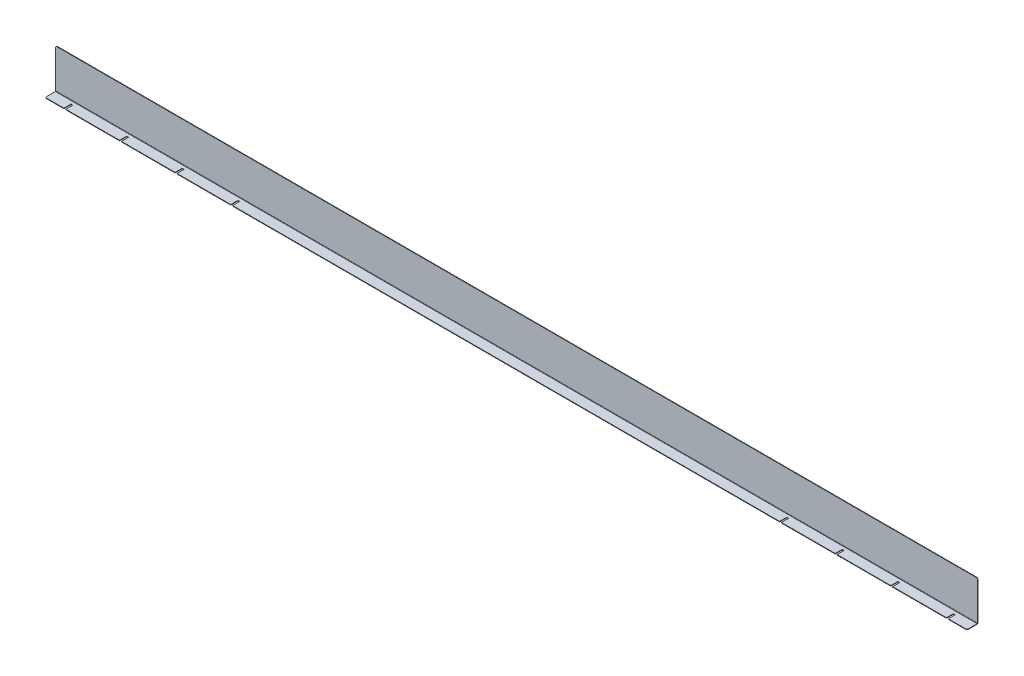
from build123d import *

# Parameters (mm, degrees)
BASE_FLANGE1_DEPTH       = 1761
FILLET1_R                = 5
SKETCH2_W                = 7
SKETCH2_H                = 35
CUT_EXTRUDE1_DEPTH       = 10
PATTERN_LINEAR_1_COUNT   = 4
PATTERN_LINEAR_1_PITCH   = 212.51
MIRROR_1_COPY_1_SKETCH_W = 7
MIRROR_1_COPY_1_SKETCH_H = 35
MIRROR_1_COPY_1_DEPTH    = 10
MIRROR_1_COPY_2_SKETCH_W = 7
MIRROR_1_COPY_2_SKETCH_H = 35
MIRROR_1_COPY_2_DEPTH    = 10
MIRROR_1_COPY_3_SKETCH_W = 7
MIRROR_1_COPY_3_SKETCH_H = 35
MIRROR_1_COPY_3_DEPTH    = 10


# Sheet-metal steps are written as plain solids
with BuildPart() as part:
    # Sketch1 → Base-Flange1 (new, symmetric)
    with BuildSketch(Plane(origin=(0, 0, 0), x_dir=(0, 0, -1), z_dir=(1, 0, 0))):
        with BuildLine():
            Line((-40, 0), (-1.3, 0))
            ThreePointArc((-1.3, 0), (-0.380761184, 0.380761184), (0, 1.3))
            Line((0, 1.3), (0, 150))
            Line((0, 150), (2, 150))
            Line((2, 150), (2, 1.3))
            ThreePointArc((2, 1.3), (1.033452378, -1.033452378), (-1.3, -2))
            Line((-1.3, -2), (-40, -2))
            Line((-40, -2), (-40, 0))
        make_face()
    extrude(amount=BASE_FLANGE1_DEPTH, both=True)

    # Fillet1
    fillet1_edges = [part.edges().sort_by_distance(p)[0] for p in [
        (1761, -1, 40),
        (-1761, -1, 40),
        (1761, 150, -1),
        (-1761, 150, -1),
    ]]
    fillet(fillet1_edges, radius=FILLET1_R)

    # Sketch2 → Cut-Extrude1 (cut)
    with BuildSketch(Plane(origin=(0, 0, 0), x_dir=(1, 0, 0), z_dir=(0, 1, 0))):
        with Locations((-1686, -30.5)):
            Rectangle(SKETCH2_W, SKETCH2_H)
    cut_extrude1 = extrude(amount=-CUT_EXTRUDE1_DEPTH, mode=Mode.SUBTRACT)

    # 阵列(线性)1: Cut-Extrude1 ×4
    with Locations(*[(i * PATTERN_LINEAR_1_PITCH, 0, 0) for i in range(1, PATTERN_LINEAR_1_COUNT)]):
        add(cut_extrude1, mode=Mode.SUBTRACT)

    # 镜向1: Cut-Extrude1 across plane
    add(cut_extrude1.mirror(Plane.ZY), mode=Mode.SUBTRACT)

    # 镜向1 copy 1 sketch → 镜向1 copy 1 (cut)
    with BuildSketch(Plane(origin=(-212.51, 0, 0), x_dir=(-1, 0, 0), z_dir=(0, 1, 0))):
        with Locations((-1686, 30.5)):
            Rectangle(MIRROR_1_COPY_1_SKETCH_W, MIRROR_1_COPY_1_SKETCH_H)
    extrude(amount=-MIRROR_1_COPY_1_DEPTH, mode=Mode.SUBTRACT)

    # 镜向1 copy 2 sketch → 镜向1 copy 2 (cut)
    with BuildSketch(Plane(origin=(-425.02, 0, 0), x_dir=(-1, 0, 0), z_dir=(0, 1, 0))):
        with Locations((-1686, 30.5)):
            Rectangle(MIRROR_1_COPY_2_SKETCH_W, MIRROR_1_COPY_2_SKETCH_H)
    extrude(amount=-MIRROR_1_COPY_2_DEPTH, mode=Mode.SUBTRACT)

    # 镜向1 copy 3 sketch → 镜向1 copy 3 (cut)
    with BuildSketch(Plane(origin=(-637.53, 0, 0), x_dir=(-1, 0, 0), z_dir=(0, 1, 0))):
        with Locations((-1686, 30.5)):
            Rectangle(MIRROR_1_COPY_3_SKETCH_W, MIRROR_1_COPY_3_SKETCH_H)
    extrude(amount=-MIRROR_1_COPY_3_DEPTH, mode=Mode.SUBTRACT)


solid = part.part
